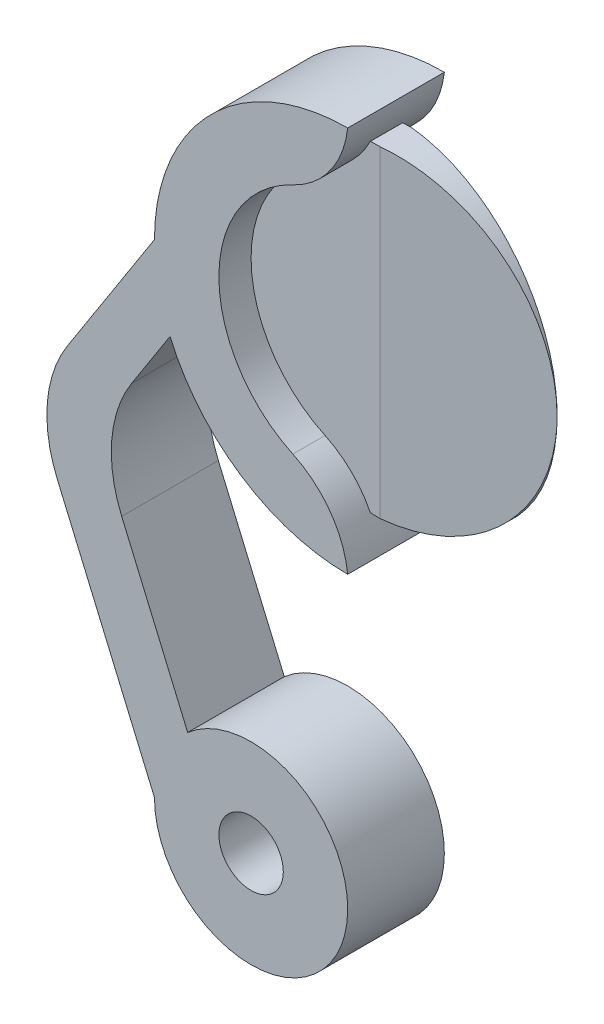
from build123d import *

# Parameters (mm, degrees)
BOSS_EXTRUDE1_DEPTH      = 15
FILLET1_R                = 20
FILLET2_R                = 15
BOSS_EXTRUDE2_DEPTH      = 25
BOSS_EXTRUDE2_DEPTH_BACK = 21
SKETCH2_W                = 5
SKETCH2_H                = 60
CUT_EXTRUDE1_DEPTH       = 5
CUT_EXTRUDE2_DEPTH       = 62


with BuildPart() as part:
    # Sketch1 → Boss-Extrude1 (new body)
    # profile 1 of 6: a face of its own
    with BuildSketch(Plane.XY):
        with BuildLine():
            Line((-20, -30), (-30, -30))
            ThreePointArc((-30, -30), (-29.388396861, -36.026784376), (-27.578524672, -41.807835403))
            Line((-27.578524672, -41.807835403), (-20, -30))
        make_face()
    # profile 2 of 6: a face of its own
    with BuildSketch(Plane.XY):
        with BuildLine():
            Line((0, -10), (0, 0))
            ThreePointArc((0, 0), (-21.213203436, -8.786796564), (-30, -30))
            Line((-30, -30), (-20, -30))
            ThreePointArc((-20, -30), (-14.142135624, -15.857864376), (0, -10))
        make_face()
    # profile 3 of 6: a face of its own
    with BuildSketch(Plane.XY):
        with BuildLine():
            ThreePointArc((0, -50), (-14.142135624, -44.142135624), (-20, -30))
            Line((-20, -30), (-27.578524672, -41.807835403))
            ThreePointArc((-27.578524672, -41.807835403), (-16.519154608, -55.04231481), (0, -60))
            Line((0, -60), (0, -50))
        make_face()
    # profile 4 of 6: a face of its own
    with BuildSketch(Plane.XY):
        with BuildLine():
            ThreePointArc((-27.578524672, -41.807835403), (-29.388396861, -36.026784376), (-30, -30))
            Line((-30, -30), (-49.254650189, -60))
            Line((-49.254650189, -60), (-30, -105))
            ThreePointArc((-30, -105), (-28.650020621, -98.780921528), (-24.84307506, -93.681260081))
            Line((-24.84307506, -93.681260081), (-39.254650189, -60))
            Line((-39.254650189, -60), (-27.578524672, -41.807835403))
        make_face()
    # profile 5 of 6: a face of its own
    with BuildSketch(Plane.XY):
        with BuildLine():
            ThreePointArc((-24.84307506, -93.681260081), (-28.650020621, -98.780921528), (-30, -105))
            Line((-30, -105), (-20, -105))
            Line((-20, -105), (-24.84307506, -93.681260081))
        make_face()
    # profile 6 of 6: a face of its own
    with BuildSketch(Plane.XY):
        with BuildLine():
            Line((-20, -105), (-30, -105))
            ThreePointArc((-30, -105), (-15, -120), (0, -105))
            ThreePointArc((0, -105), (-8.780921528, -91.349979379), (-24.84307506, -93.681260081))
            Line((-24.84307506, -93.681260081), (-20, -105))
        make_face()
        with BuildLine():
            ThreePointArc((-10, -105), (-15, -110), (-20, -105))
            ThreePointArc((-20, -105), (-15, -100), (-10, -105))
        make_face(mode=Mode.SUBTRACT)
    extrude(amount=BOSS_EXTRUDE1_DEPTH)

    # Fillet1
    fillet1_edges = [part.edges().sort_by_distance(p)[0] for p in [
        (-39.254650189, -60, 7.5),
        (-49.254650189, -60, 7.5),
    ]]
    fillet(fillet1_edges, radius=FILLET1_R)

    # Fillet2
    # the kernel refuses this fillet: 15 mm, written as the material it takes off along each edge
    with BuildSketch(Plane(origin=(0, -50, -25), x_dir=(-0.9759000729485309, 0.21821789023600283, 0), z_dir=(0, 0, 1))) as fillet2_piece_1:
        with BuildLine():
            CenterArc((12.001983963, 14.638501094), FILLET2_R, 198.983752857, 58.411864495)
            Line((-2.182178902, 9.759000729), (-2.46586216, 9.661410722))
            ThreePointArc((-2.46586216, 9.661410722), (-1.383859473, 4.814034998), (-0.292770022, -0.065465367))
            Line((-0.292770022, -0.065465367), (0.065465367, -0.292770022))
            ThreePointArc((0.065465367, -0.292770022), (4.364357805, 0.181998541), (8.663250242, -0.292770022))
            Line((8.663250242, -0.292770022), (8.728715609, 0))
        make_face()
    extrude(amount=65, mode=Mode.SUBTRACT)
    with BuildSketch(Plane(origin=(0, -10, -25), x_dir=(0, 1, 0), z_dir=(0, 0, 1))) as fillet2_piece_2:
        with BuildLine():
            CenterArc((11.666666667, 14.90711985), FILLET2_R, 205.208765297, 58.411864495)
            Line((-1.904761905, 8.5183542), (-2.176190476, 8.390578887))
            ThreePointArc((-2.176190476, 8.390578887), (-0.774768563, 4.298892438), (-0.3, 0))
            Line((-0.3, 0), (0, -0.3))
            ThreePointArc((0, -0.3), (5, -0.3), (9.966666667, -0.298142397))
            Line((9.966666667, -0.298142397), (10, 0))
        make_face()
    extrude(amount=65, mode=Mode.SUBTRACT)

    # Sketch2 → Boss-Extrude2 (add, two sides: drawn at the far end of the back side and taken through both)
    with BuildSketch(Plane(origin=(0, 0, 0), x_dir=(0, 0, -1), z_dir=(1, 0, 0)).offset(-BOSS_EXTRUDE2_DEPTH_BACK)):
        with Locations((-7.5, -30)):
            Rectangle(SKETCH2_W, SKETCH2_H)
    extrude(amount=BOSS_EXTRUDE2_DEPTH + BOSS_EXTRUDE2_DEPTH_BACK)

    # Sketch3 → Cut-Extrude1 (cut)
    with BuildSketch(Plane(origin=(0, 0, 5), x_dir=(-1, 0, 0), z_dir=(0, 0, -1))):
        with BuildLine():
            Line((0, 0), (-25, 0))
            Line((-25, 0), (-25, -30.000000042))
            ThreePointArc((-25, -30.000000042), (-17.141969276, -11.802393307), (1.49223119, -5.044574817))
            ThreePointArc((1.49223119, -5.044574817), (0.523240843, -2.588215791), (0, 0))
        make_face()
        with BuildLine():
            Line((21, 0), (0, 0))
            ThreePointArc((0, 0), (11.341768853, -2.226554422), (21, -8.575714714))
            Line((21, -8.575714714), (21, 0))
        make_face()
        with BuildLine():
            ThreePointArc((1.49223119, -54.955425183), (-17.141969245, -48.197606722), (-25, -30.000000042))
            Line((-25, -30.000000042), (-25, -60))
            Line((-25, -60), (0, -60))
            ThreePointArc((0, -60), (0.523240843, -57.411784209), (1.49223119, -54.955425183))
        make_face()
        with BuildLine():
            ThreePointArc((21, -51.424285286), (11.341768853, -57.773445578), (0, -60))
            Line((0, -60), (21, -60))
            Line((21, -60), (21, -51.424285286))
        make_face()
    extrude(amount=-CUT_EXTRUDE1_DEPTH, mode=Mode.SUBTRACT)

    # Sketch4 → Cut-Extrude2 (cut)
    with BuildSketch(Plane(origin=(0, 0, 0), x_dir=(1, 0, 0), z_dir=(0, 1, 0))):
        Polygon((0, -5), (25, -7.5), (25, -5), align=None)
        Polygon((25, -10), (25, -7.5), (0, -10), align=None)
    extrude(amount=-CUT_EXTRUDE2_DEPTH, mode=Mode.SUBTRACT)


solid = part.part
